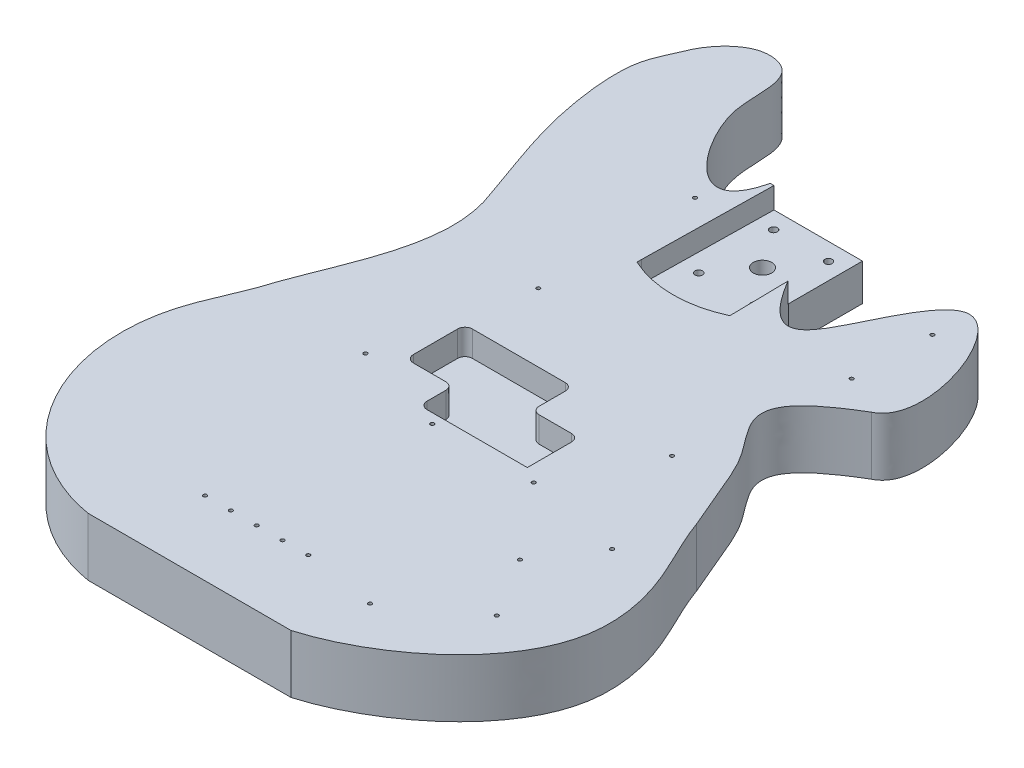
from build123d import *

# Parameters (mm, degrees)
BOSS_EXTRUDE1_DEPTH = 40.005
CUT_EXTRUDE1_DEPTH  = 14.605
SKETCH3_R           = 6.35
SKETCH3_R_2         = 2.54
CUT_EXTRUDE2_DEPTH  = 539.066679286
CUT_EXTRUDE3_DEPTH  = 17.5514
SKETCH5_R           = 1.27
CUT_EXTRUDE4_DEPTH  = 17.78


with BuildPart() as part:
    # Sketch1 → Boss-Extrude1 (new body)
    with BuildSketch(Plane(origin=(0, 0, 0), x_dir=(1, 0, 0), z_dir=(0, 1, 0))):
        with BuildLine():
            Line((-31.75, 431.8), (31.75, 431.8))
            Line((31.75, 431.8), (31.75, 381))
            add(Edge.make_bspline(
                [(139.7, 330.2), (166.445933937, 342.89199921), (123.503776034, 464.530793204), (76.812686628, 369.38946014), (59.509313942, 333.666820551), (31.75, 381)],
                knots=[0, 0, 0, 0, 0.451982316, 0.679896033, 1, 1, 1, 1], degree=3))
            add(Edge.make_bspline(
                [(146.05, 203.2), (136.159858324, 225.650446788), (132.589610525, 236.847424982), (120.383558334, 260.933031596), (109.568716266, 273.359552136), (96.590167779, 297.02427137), (109.096273913, 311.992671669), (139.7, 330.2)],
                knots=[0, 0, 0, 0, 0.338979618, 0.396393174, 0.554386404, 0.616722002, 1, 1, 1, 1], degree=3))
            add(Edge.make_bspline(
                [(69.85, 0), (111.934817577, 12.111106324), (186.014505262, 65.749693466), (170.841604559, 155.498343774), (152.338106065, 185.626315347), (146.05, 203.2)],
                knots=[0, 0, 0, 0, 0.586136039, 0.784814246, 1, 1, 1, 1], degree=3))
            Line((69.85, 0), (-69.85, 0))
            add(Edge.make_bspline(
                [(-69.85, 0), (-122.745853908, 8.894627237), (-170.373818617, 68.373598191), (-165.531190573, 154.759290659), (-147.834713243, 185.810503286), (-142.875, 203.2)],
                knots=[0, 0, 0, 0, 0.581043163, 0.78383742, 1, 1, 1, 1], degree=3))
            add(Edge.make_bspline(
                [(-142.875, 203.2), (-128.639770906, 243.099083108), (-104.490445622, 285.950192917), (-122.2248, 330.2)],
                knots=[0, 0, 0, 0, 1, 1, 1, 1], degree=3))
            add(Edge.make_bspline(
                [(-122.2248, 330.2), (-131.763508886, 357.856604277), (-146.2425508, 392.351504834), (-152.772633421, 455.278086227), (-144.543275129, 471.013225285), (-135.470443556, 492.861244858), (-120.651127827, 508.750910027), (-90.829721956, 507.317797539), (-88.364588713, 481.720202384), (-88.704714068, 444.441923985), (-43.011483466, 384.645662013), (-31.75, 431.8)],
                knots=[0, 0, 0, 0, 0.228270644, 0.373680854, 0.455314812, 0.473381506, 0.54535154, 0.564858815, 0.659457996, 0.74420055, 1, 1, 1, 1], degree=3))
        make_face()
    extrude(amount=BOSS_EXTRUDE1_DEPTH)

    # Sketch2 → Cut-Extrude1 (cut)
    with BuildSketch(Plane(origin=(0, 40.005, 0), x_dir=(1, 0, 0), z_dir=(0, 1, 0))):
        with BuildLine():
            Line((-29.21, 431.8), (31.75, 431.8))
            Line((31.75, 431.8), (33.2232, 341.9475))
            Line((33.2232, 341.9475), (33.2232, 338.8995))
            ThreePointArc((33.2232, 338.8995), (1.27, 331.7875), (-30.6832, 338.8995))
            Line((-30.6832, 338.8995), (-30.6832, 341.9475))
            Line((-30.6832, 341.9475), (-29.21, 431.8))
        make_face()
    extrude(amount=-CUT_EXTRUDE1_DEPTH, mode=Mode.SUBTRACT)

    # Sketch3 → Cut-Extrude2 (cut, through all)
    with BuildSketch(Plane(origin=(0, 25.4, 0), x_dir=(1, 0, 0), z_dir=(0, 1, 0))):
        with Locations((1.27, 393.3952)):
            Circle(SKETCH3_R)
        with Locations((-17.526, 419.862)):
            Circle(SKETCH3_R_2)
        with Locations((20.2692, 419.862)):
            Circle(SKETCH3_R_2)
        with Locations((20.59715074, 368.3)):
            Circle(SKETCH3_R_2)
        with Locations((-17.549082464, 368.3)):
            Circle(SKETCH3_R_2)
    extrude(amount=-CUT_EXTRUDE2_DEPTH, mode=Mode.SUBTRACT)

    # Sketch4 → Cut-Extrude3 (cut)
    with BuildSketch(Plane(origin=(0, 40.005, 0), x_dir=(1, 0, 0), z_dir=(0, 1, 0))):
        with BuildLine():
            Line((-47.498, 242.316), (16.51, 242.316))
            ThreePointArc((16.51, 242.316), (20.102102448, 240.828102448), (21.59, 237.236))
            Line((21.59, 237.236), (21.59, 219.202))
            ThreePointArc((21.59, 219.202), (23.077897552, 215.609897552), (26.67, 214.122))
            Line((26.67, 214.122), (49.022, 214.122))
            ThreePointArc((49.022, 214.122), (52.614102448, 212.634102448), (54.102, 209.042))
            Line((54.102, 209.042), (54.102, 178.562))
            Line((54.102, 178.562), (-14.986, 178.562))
            ThreePointArc((-14.986, 178.562), (-18.578102448, 180.049897552), (-20.066, 183.642))
            Line((-20.066, 183.642), (-20.066, 196.596))
            ThreePointArc((-20.066, 196.596), (-21.553897552, 200.188102448), (-25.146, 201.676))
            Line((-25.146, 201.676), (-47.498, 201.676))
            ThreePointArc((-47.498, 201.676), (-51.090102448, 203.163897552), (-52.578, 206.756))
            Line((-52.578, 206.756), (-52.578, 237.236))
            ThreePointArc((-52.578, 237.236), (-51.090102448, 240.828102448), (-47.498, 242.316))
        make_face()
    extrude(amount=-CUT_EXTRUDE3_DEPTH, mode=Mode.SUBTRACT)

    # Sketch5 → Cut-Extrude4 (cut)
    with BuildSketch(Plane(origin=(0, 40.005, 0), x_dir=(1, 0, 0), z_dir=(0, 1, 0))):
        with Locations((-49.082798919, 397.256)):
            Circle(SKETCH5_R)
        with Locations((-49.082798919, 289.306)):
            Circle(SKETCH5_R)
        with Locations((-69.720298919, 190.881)):
            Circle(SKETCH5_R)
        with Locations((112.842201081, 343.281)):
            Circle(SKETCH5_R)
        with Locations((114.417001081, 397.256)):
            Circle(SKETCH5_R)
        with Locations((96.967201081, 235.331)):
            Circle(SKETCH5_R)
        with Locations((131.892201081, 159.131)):
            Circle(SKETCH5_R)
        with Locations((131.892201081, 79.756)):
            Circle(SKETCH5_R)
        with Locations((81.092201081, 43.2435)):
            Circle(SKETCH5_R)
        with Locations((106.492201081, 121.031)):
            Circle(SKETCH5_R)
        with Locations((65.217201081, 171.831)):
            Circle(SKETCH5_R)
        with Locations((-40.192798919, 50.8508)):
            Circle(SKETCH5_R)
        with Locations((-22.412798919, 50.8508)):
            Circle(SKETCH5_R)
        with Locations((-4.632798919, 50.8508)):
            Circle(SKETCH5_R)
        with Locations((13.147201081, 50.8508)):
            Circle(SKETCH5_R)
        with Locations((30.927201081, 50.8508)):
            Circle(SKETCH5_R)
        with Locations((-4.632798919, 171.831)):
            Circle(SKETCH5_R)
    extrude(amount=-CUT_EXTRUDE4_DEPTH, mode=Mode.SUBTRACT)


solid = part.part
